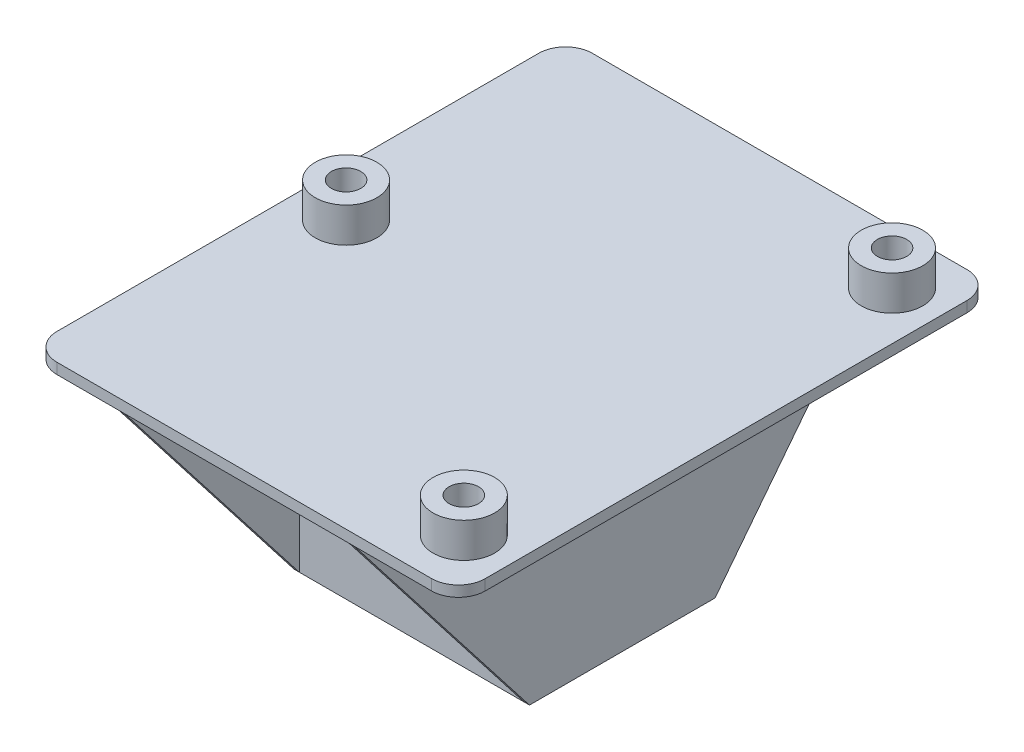
from build123d import *

# Parameters (mm, degrees)
BOSS_EXTRUDE1_DEPTH     = 2
SKETCH2_R               = 2.75
CUT_EXTRUDE1_DEPTH      = 65.062469512
BOSS_EXTRUDE3_START     = 6.5
SKETCH3_2_R             = 5.75
SKETCH3_2_R_2           = 2.75
BOSS_EXTRUDE3_DEPTH     = 6.5
BOSS_EXTRUDE2_START     = 4.5
SKETCH3_R               = 5.75
SKETCH3_R_2             = 2.75
BOSS_EXTRUDE2_DEPTH     = 4.5
SKETCH7_W               = 42
SKETCH7_H               = 32.666666666
BOSS_EXTRUDE4_DEPTH     = 42
CUT_EXTRUDE2_DEPTH      = 91.320318866
CUT_EXTRUDE2_DEPTH_BACK = 91.320318866
SKETCH9_R               = 5
SKETCH9_R_2             = 1.5
CUT_EXTRUDE3_DEPTH      = 89.869442317


with BuildPart() as part:
    # Sketch1 → Boss-Extrude1 (new body)
    with BuildSketch(Plane(origin=(0, 0, 0), x_dir=(1, 0, 0), z_dir=(0, 1, 0))):
        with BuildLine():
            Line((-35, 50), (35, 50))
            ThreePointArc((35, 50), (38.535533906, 48.535533906), (40, 45))
            Line((40, 45), (40, -45))
            ThreePointArc((40, -45), (38.535533906, -48.535533906), (35, -50))
            Line((35, -50), (-35, -50))
            ThreePointArc((-35, -50), (-38.535533906, -48.535533906), (-40, -45))
            Line((-40, -45), (-40, 45))
            ThreePointArc((-40, 45), (-38.535533906, 48.535533906), (-35, 50))
        make_face()
    extrude(amount=BOSS_EXTRUDE1_DEPTH)

    # Sketch2 → Cut-Extrude1 (cut, through all)
    with BuildSketch(Plane(origin=(0, 2, 0), x_dir=(1, 0, 0), z_dir=(0, 1, 0))):
        with Locations((-31, 0)):
            Circle(SKETCH2_R)
        with Locations((31, 40)):
            Circle(SKETCH2_R)
        with Locations((31, -40)):
            Circle(SKETCH2_R)
    extrude(amount=-CUT_EXTRUDE1_DEPTH, mode=Mode.SUBTRACT)

    # Sketch3<2> → Boss-Extrude3 (add)
    # profile 1 of 3: a face of its own
    with BuildSketch(Plane(origin=(0, 2, 0), x_dir=(1, 0, 0), z_dir=(0, 1, 0)).offset(BOSS_EXTRUDE3_START)):
        with Locations((-31, 0)):
            Circle(SKETCH3_2_R)
        with Locations((-31, 0)):
            Circle(SKETCH3_2_R_2, mode=Mode.SUBTRACT)
    # profile 2 of 3: a face of its own
    with BuildSketch(Plane(origin=(0, 2, 0), x_dir=(1, 0, 0), z_dir=(0, 1, 0)).offset(BOSS_EXTRUDE3_START)):
        with Locations((31, 40)):
            Circle(SKETCH3_2_R)
        with Locations((31, 40)):
            Circle(SKETCH3_2_R_2, mode=Mode.SUBTRACT)
    # profile 3 of 3: a face of its own
    with BuildSketch(Plane(origin=(0, 2, 0), x_dir=(1, 0, 0), z_dir=(0, 1, 0)).offset(BOSS_EXTRUDE3_START)):
        with Locations((31, -40)):
            Circle(SKETCH3_2_R)
        with Locations((31, -40)):
            Circle(SKETCH3_2_R_2, mode=Mode.SUBTRACT)
    extrude(amount=-BOSS_EXTRUDE3_DEPTH)

    # Sketch3 → Boss-Extrude2 (add)
    # profile 1 of 3: a face of its own
    with BuildSketch(Plane(origin=(0, 2, 0), x_dir=(1, 0, 0), z_dir=(0, 1, 0)).offset(BOSS_EXTRUDE2_START)):
        with Locations((-31, 0)):
            Circle(SKETCH3_R)
        with Locations((-31, 0)):
            Circle(SKETCH3_R_2, mode=Mode.SUBTRACT)
    # profile 2 of 3: a face of its own
    with BuildSketch(Plane(origin=(0, 2, 0), x_dir=(1, 0, 0), z_dir=(0, 1, 0)).offset(BOSS_EXTRUDE2_START)):
        with Locations((31, 40)):
            Circle(SKETCH3_R)
        with Locations((31, 40)):
            Circle(SKETCH3_R_2, mode=Mode.SUBTRACT)
    # profile 3 of 3: a face of its own
    with BuildSketch(Plane(origin=(0, 2, 0), x_dir=(1, 0, 0), z_dir=(0, 1, 0)).offset(BOSS_EXTRUDE2_START)):
        with Locations((31, -40)):
            Circle(SKETCH3_R)
        with Locations((31, -40)):
            Circle(SKETCH3_R_2, mode=Mode.SUBTRACT)
    extrude(amount=-BOSS_EXTRUDE2_DEPTH)

    # Sketch7 → Boss-Extrude4 (add)
    with BuildSketch(Plane.XZ):
        Polygon((19.6, 50), (20.6, 50), (20.6, -50), (19.6, -50), (19.6, -17.333333333), (-22.4, -17.333333333), (-22.4, -50), (-23.4, -50), (-23.4, 50), (-22.4, 50), (-22.4, 17.333333333), (19.6, 17.333333333), align=None)
        with Locations((-1.4, 0)):
            Rectangle(SKETCH7_W, SKETCH7_H, mode=Mode.SUBTRACT)
    extrude(amount=BOSS_EXTRUDE4_DEPTH)

    # Sketch8 → Cut-Extrude2 (cut, two sides: drawn at the far end of the back side and taken through both)
    with BuildSketch(Plane(origin=(-22.4, 0, 0), x_dir=(0, 0, -1), z_dir=(1, 0, 0)).offset(-CUT_EXTRUDE2_DEPTH_BACK)):
        Polygon((-50, 0), (-17.333333333, -42), (-50, -42), align=None)
        Polygon((17.333333333, -42), (50, 0), (50, -42), align=None)
    extrude(amount=CUT_EXTRUDE2_DEPTH + CUT_EXTRUDE2_DEPTH_BACK, mode=Mode.SUBTRACT)

    # Sketch9 → Cut-Extrude3 (cut, through all)
    with BuildSketch(Plane.XY.offset(17.333333333)):
        with Locations((-1.4, -21)):
            Circle(SKETCH9_R)
        with Locations((-10.238834765, -12.161165235)):
            Circle(SKETCH9_R_2)
        with Locations((-10.238834765, -29.838834765)):
            Circle(SKETCH9_R_2)
        with Locations((7.438834765, -12.161165235)):
            Circle(SKETCH9_R_2)
        with Locations((7.438834765, -29.838834765)):
            Circle(SKETCH9_R_2)
    extrude(amount=-CUT_EXTRUDE3_DEPTH, mode=Mode.SUBTRACT)


solid = part.part
